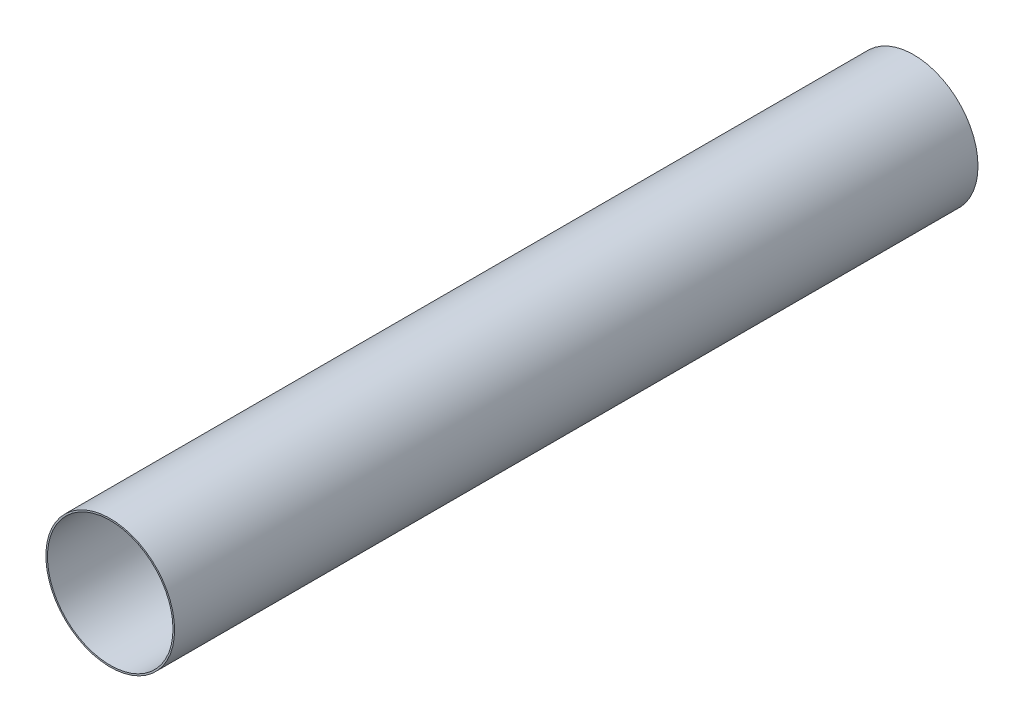
from build123d import *

# Parameters (mm, degrees)
SKETCH1_R           = 81.375
SKETCH1_R_2         = 79.375
BOSS_EXTRUDE1_DEPTH = 508


with BuildPart() as part:
    # Sketch1 → Boss-Extrude1 (new, symmetric)
    with BuildSketch(Plane.XY):
        Circle(SKETCH1_R)
        Circle(SKETCH1_R_2, mode=Mode.SUBTRACT)
    extrude(amount=BOSS_EXTRUDE1_DEPTH, both=True)


solid = part.part
